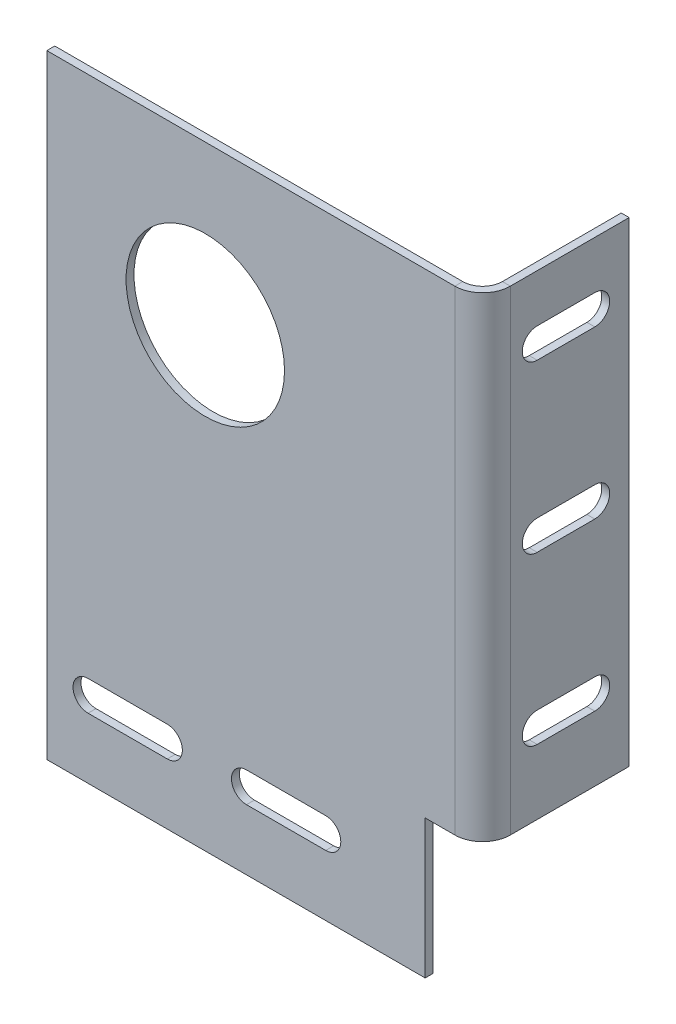
from build123d import *

# Parameters (mm, degrees)
SKETCH1_W                    = 139.7
SKETCH1_H                    = 152.4
SKETCH1_R                    = 25.4
BOSS_EXTRUDE1_DEPTH          = 2.54
EDGE_FLANGE1_STRIP_W         = 22.86
EDGE_FLANGE1_STRIP_H         = 2.54
EDGE_FLANGE1_STRIP_CUT_DEPTH = 152.4
EDGE_FLANGE1_DEPTH           = 152.4
CUT_EXTRUDE3_DEPTH           = 2.54
SKETCH10_W                   = 121.292072418
SKETCH10_H                   = 2.54
BOSS_EXTRUDE2_DEPTH          = 44.45
CUT_EXTRUDE2_DEPTH           = 44.45


# Sheet-metal steps are written as plain solids
with BuildPart() as part:
    # Sketch1 → Boss-Extrude1 (new body)
    with BuildSketch(Plane.XY):
        with Locations((-5.388148668, -29.389901823)):
            Rectangle(SKETCH1_W, SKETCH1_H)
        with Locations((-24.438148668, -3.989901823)):
            Circle(SKETCH1_R, mode=Mode.SUBTRACT)
    extrude(amount=BOSS_EXTRUDE1_DEPTH)

    # Edge-Flange1 strip (across the edge) → Edge-Flange1 strip cut (cut)
    with BuildSketch(Plane(origin=(64.461851332, 46.810098177, 0), x_dir=(-1, 0, 0), z_dir=(0, -1, 0))):
        with Locations((-2.54, -1.27)):
            Rectangle(EDGE_FLANGE1_STRIP_W, EDGE_FLANGE1_STRIP_H)
    extrude(amount=EDGE_FLANGE1_STRIP_CUT_DEPTH, mode=Mode.SUBTRACT)

    # Edge-Flange1 section (across the edge) → Edge-Flange1 (add)
    with BuildSketch(Plane(origin=(64.461851332, 46.810098177, 0), x_dir=(-1, 0, 0), z_dir=(0, -1, 0))):
        with BuildLine():
            Line((0, 6.35), (0, 44.45))
            Line((0, 44.45), (2.54, 44.45))
            Line((2.54, 44.45), (2.54, 6.35))
            ThreePointArc((2.54, 6.35), (4.399871939, 1.859871939), (8.89, 0))
            Line((8.89, 0), (8.89, -2.54))
            ThreePointArc((8.89, -2.54), (2.603820715, 0.063820715), (0, 6.35))
        make_face()
    extrude(amount=EDGE_FLANGE1_DEPTH)

    # Sketch9 → Cut-Extrude3 (cut)
    with BuildSketch(Plane.ZY.offset(-61.921851332)):
        with BuildLine():
            Line((-14.954545697, 31.473568276), (-33.436292004, 31.473568276))
            ThreePointArc((-33.436292004, 31.473568276), (-38.198792004, 26.711068276), (-33.436292004, 21.948568276))
            Line((-33.436292004, 21.948568276), (-14.954545697, 21.948568276))
            ThreePointArc((-14.954545697, 21.948568276), (-10.192045697, 26.711068276), (-14.954545697, 31.473568276))
        make_face()
        with BuildLine():
            Line((-14.954545697, -21.866431724), (-33.436292004, -21.866431724))
            ThreePointArc((-33.436292004, -21.866431724), (-38.198792004, -26.628931724), (-33.436292004, -31.391431724))
            Line((-33.436292004, -31.391431724), (-14.954545697, -31.391431724))
            ThreePointArc((-14.954545697, -31.391431724), (-10.192045697, -26.628931724), (-14.954545697, -21.866431724))
        make_face()
        with BuildLine():
            Line((-14.954545697, -75.206431724), (-33.436292004, -75.206431724))
            ThreePointArc((-33.436292004, -75.206431724), (-38.198792004, -79.968931724), (-33.436292004, -84.731431724))
            Line((-33.436292004, -84.731431724), (-14.954545697, -84.731431724))
            ThreePointArc((-14.954545697, -84.731431724), (-10.192045697, -79.968931724), (-14.954545697, -75.206431724))
        make_face()
    extrude(amount=-CUT_EXTRUDE3_DEPTH, mode=Mode.SUBTRACT)

    # Sketch10 → Boss-Extrude2 (add)
    with BuildSketch(Plane.XZ.offset(105.589901823)):
        with Locations((-14.592112459, 1.27)):
            Rectangle(SKETCH10_W, SKETCH10_H)
    extrude(amount=BOSS_EXTRUDE2_DEPTH)

    # Sketch11 → Cut-Extrude2 (cut)
    with BuildSketch(Plane.XY.offset(2.54)):
        with BuildLine():
            Line((-62.024050091, -120.904110835), (-36.624050091, -120.904110835))
            ThreePointArc((-36.624050091, -120.904110835), (-31.798050091, -125.730110835), (-36.624050091, -130.556110835))
            Line((-36.624050091, -130.556110835), (-62.024050091, -130.556110835))
            ThreePointArc((-62.024050091, -130.556110835), (-66.850050091, -125.730110835), (-62.024050091, -120.904110835))
        make_face()
        with BuildLine():
            Line((-11.224050091, -120.904110835), (14.175949909, -120.904110835))
            ThreePointArc((14.175949909, -120.904110835), (19.001949909, -125.730110835), (14.175949909, -130.556110835))
            Line((14.175949909, -130.556110835), (-11.224050091, -130.556110835))
            ThreePointArc((-11.224050091, -130.556110835), (-16.050050091, -125.730110835), (-11.224050091, -120.904110835))
        make_face()
    extrude(amount=-CUT_EXTRUDE2_DEPTH, mode=Mode.SUBTRACT)


solid = part.part
